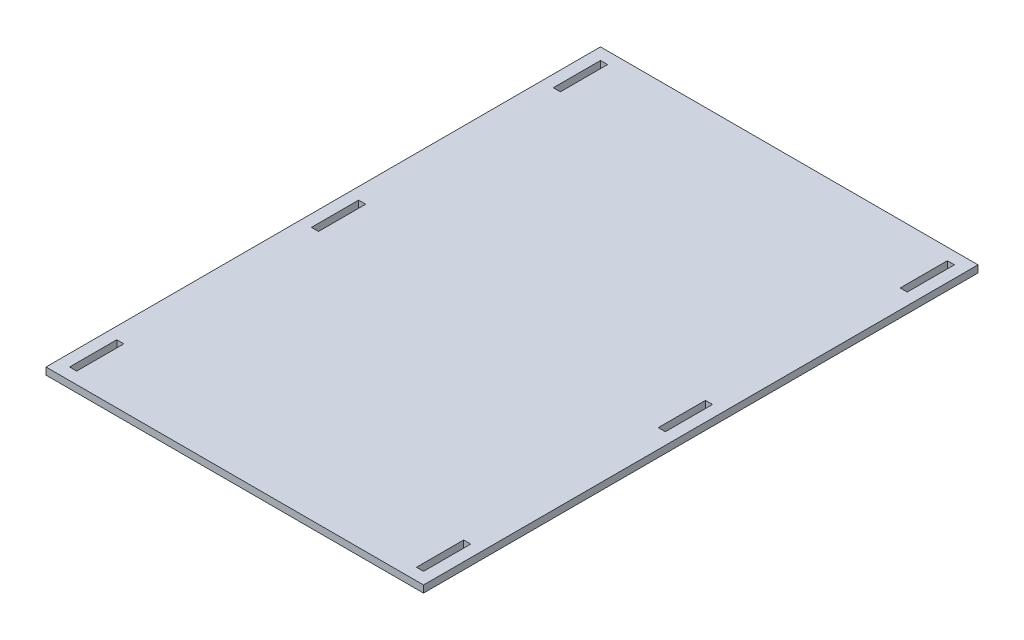
from build123d import *

# Parameters (mm, degrees)
SKETCH1_W            = 320
SKETCH1_H            = 470
BOSS_EXTRUDE1_DEPTH  = 6
SKETCH2_W            = 6
SKETCH2_H            = 40
CUT_EXTRUDE1_DEPTH   = 6
LPATTERN1_COUNT      = 2
LPATTERN1_PITCH      = 294
LPATTERN1_COUNT_DIR2 = 3
LPATTERN1_PITCH_DIR2 = 205


with BuildPart() as part:
    # Sketch1 → Boss-Extrude1 (new body)
    with BuildSketch(Plane(origin=(0, 0, 0), x_dir=(1, 0, 0), z_dir=(0, 1, 0))):
        with Locations((160, 235)):
            Rectangle(SKETCH1_W, SKETCH1_H)
    extrude(amount=BOSS_EXTRUDE1_DEPTH)

    # Sketch2 → Cut-Extrude1 (cut)
    with BuildSketch(Plane(origin=(0, 6, 0), x_dir=(1, 0, 0), z_dir=(0, 1, 0))):
        with Locations((13, 440)):
            Rectangle(SKETCH2_W, SKETCH2_H)
    cut_extrude1 = extrude(amount=-CUT_EXTRUDE1_DEPTH, mode=Mode.SUBTRACT)

    # LPattern1: Cut-Extrude1 2 × 3
    with Locations(*[(i * LPATTERN1_PITCH, 0, j * LPATTERN1_PITCH_DIR2) for i in range(LPATTERN1_COUNT) for j in range(LPATTERN1_COUNT_DIR2) if (i, j) != (0, 0)]):
        add(cut_extrude1, mode=Mode.SUBTRACT)


solid = part.part
